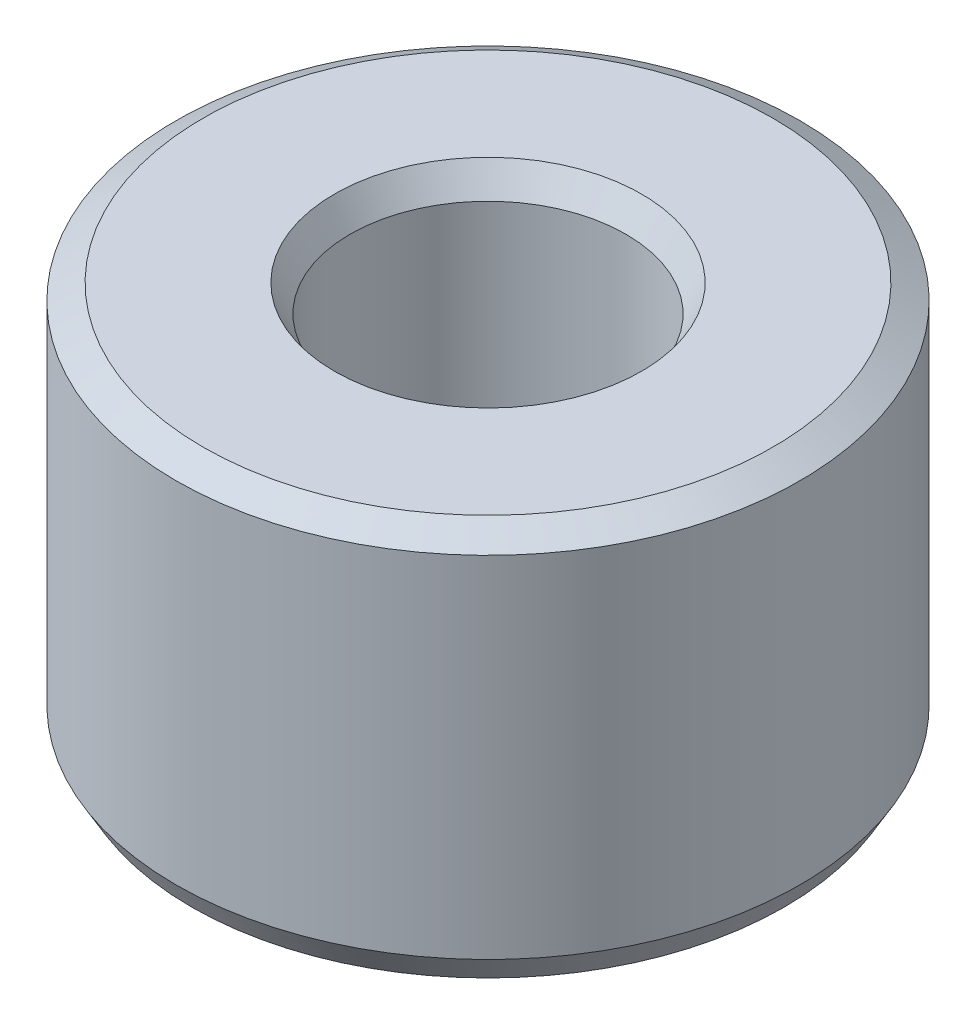
from build123d import *
from OCP.BRepFilletAPI import BRepFilletAPI_MakeChamfer

# Parameters (mm, degrees)
SKETCH1_R           = 57.5
BOSS_EXTRUDE1_DEPTH = 72.37429168
SKETCH2_R           = 25.430544321
CUT_EXTRUDE1_DEPTH  = 109.860176815
CHAMFER1_SIZE       = 2.875760996
CHAMFER1_SIZE2      = 4.980964155


with BuildPart() as part:
    # Sketch1 → Boss-Extrude1 (new body)
    with BuildSketch(Plane(origin=(0, 0, 0), x_dir=(1, 0, 0), z_dir=(0, 1, 0))):
        Circle(SKETCH1_R)
    extrude(amount=BOSS_EXTRUDE1_DEPTH)

    # Sketch2 → Cut-Extrude1 (cut, through all)
    with BuildSketch(Plane(origin=(0, 0, 0), x_dir=(1, 0, 0), z_dir=(0, 1, 0))):
        Circle(SKETCH2_R)
    extrude(amount=CUT_EXTRUDE1_DEPTH, mode=Mode.SUBTRACT)

    # Chamfer1: one chamfer whose edges measure the first distance from different faces: ONE call of the kernel's chamfer builder (chamfer() names one face for all edges)
    chamfer1_edges_1 = [part.edges().sort_by_distance(p)[0] for p in [
        (-25.430544321, 72.37429168, 0),
    ]]
    chamfer1_side_1 = [part.faces().sort_by_distance(p)[0] for p in [
        (-55.873654403, 72.37429168, 0),
    ]]
    chamfer1_edges_2 = [part.edges().sort_by_distance(p)[0] for p in [
        (-25.430544321, 0, 0),
    ]]
    chamfer1_side_2 = [part.faces().sort_by_distance(p)[0] for p in [
        (-25.430544321, 36.18714584, 0),
    ]]
    chamfer1_edges_3 = [part.edges().sort_by_distance(p)[0] for p in [
        (-57.5, 0, 0),
    ]]
    chamfer1_side_3 = [part.faces().sort_by_distance(p)[0] for p in [
        (-55.873654403, 0, 0),
    ]]
    chamfer1_edges_4 = [part.edges().sort_by_distance(p)[0] for p in [
        (-57.5, 72.37429168, 0),
    ]]
    chamfer1_side_4 = [part.faces().sort_by_distance(p)[0] for p in [
        (-57.5, 36.18714584, 0),
    ]]
    chamfer1 = BRepFilletAPI_MakeChamfer(part.part.solid().wrapped)
    for e in chamfer1_edges_1:
        chamfer1.Add(CHAMFER1_SIZE, CHAMFER1_SIZE2, e.wrapped, chamfer1_side_1[0].wrapped)  # the first distance lies on this face
    for e in chamfer1_edges_2:
        chamfer1.Add(CHAMFER1_SIZE, CHAMFER1_SIZE2, e.wrapped, chamfer1_side_2[0].wrapped)  # the first distance lies on this face
    for e in chamfer1_edges_3:
        chamfer1.Add(CHAMFER1_SIZE, CHAMFER1_SIZE2, e.wrapped, chamfer1_side_3[0].wrapped)  # the first distance lies on this face
    for e in chamfer1_edges_4:
        chamfer1.Add(CHAMFER1_SIZE, CHAMFER1_SIZE2, e.wrapped, chamfer1_side_4[0].wrapped)  # the first distance lies on this face
    add(Compound.cast(chamfer1.Shape()), mode=Mode.REPLACE)


solid = part.part
